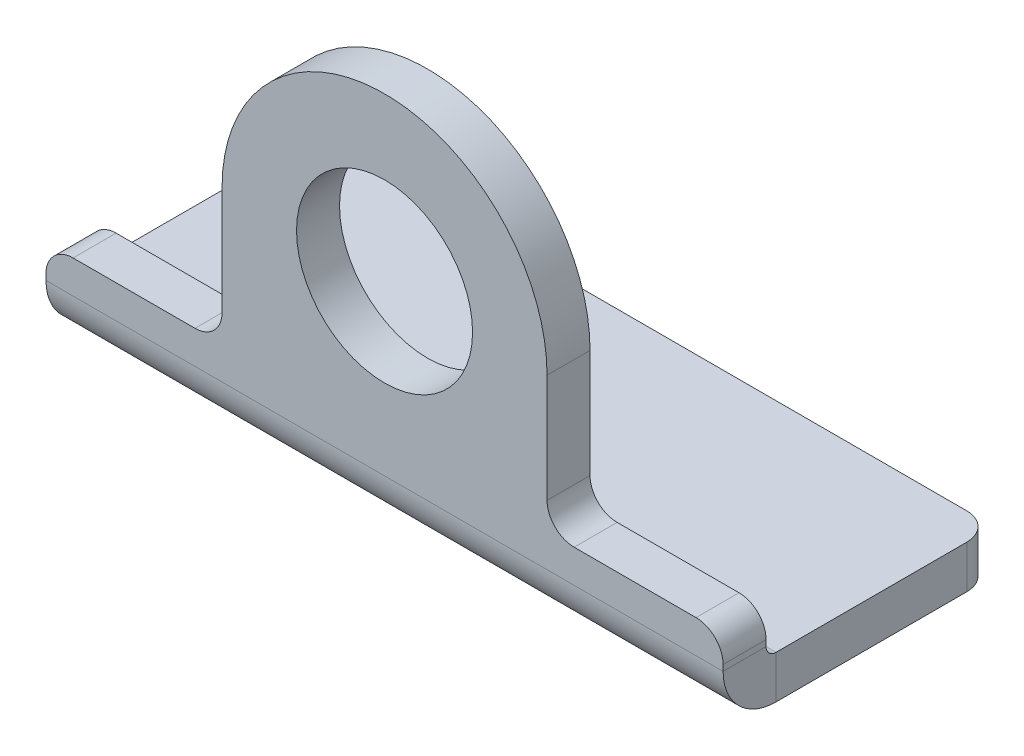
from build123d import *

# Parameters (mm, degrees)
SKETCH1_R                    = 6.5
BASE_FLANGE1_DEPTH           = 3.175
EDGE_FLANGE1_STRIP_W         = 14.1732
EDGE_FLANGE1_STRIP_H         = 3.175
EDGE_FLANGE1_STRIP_CUT_DEPTH = 50
EDGE_FLANGE1_DEPTH           = 50
FILLET2_R                    = 2


# Sheet-metal steps are written as plain solids
with BuildPart() as part:
    # Sketch1 → Base-Flange1 (new body)
    with BuildSketch(Plane.XY):
        with BuildLine():
            Line((-25, 0), (25, 0))
            Line((25, 0), (25, 1.175))
            ThreePointArc((25, 1.175), (24.414213562, 2.589213562), (23, 3.175))
            Line((23, 3.175), (14, 3.175))
            ThreePointArc((14, 3.175), (12.585786438, 3.760786438), (12, 5.175))
            Line((12, 5.175), (12, 13.175))
            ThreePointArc((12, 13.175), (0, 25.175), (-12, 13.175))
            Line((-12, 13.175), (-12, 5.175))
            ThreePointArc((-12, 5.175), (-12.585786438, 3.760786438), (-14, 3.175))
            Line((-14, 3.175), (-23, 3.175))
            ThreePointArc((-23, 3.175), (-24.414213562, 2.589213562), (-25, 1.175))
            Line((-25, 1.175), (-25, 0))
        make_face()
        with Locations((0, 13.175)):
            Circle(SKETCH1_R, mode=Mode.SUBTRACT)
    extrude(amount=-BASE_FLANGE1_DEPTH)

    # Edge-Flange1 strip (across the edge) → Edge-Flange1 strip cut (cut)
    with BuildSketch(Plane(origin=(25, 0, -3.175), x_dir=(0, 1, 0), z_dir=(-1, 0, 0))):
        with Locations((-6.35, -1.5875)):
            Rectangle(EDGE_FLANGE1_STRIP_W, EDGE_FLANGE1_STRIP_H)
    extrude(amount=EDGE_FLANGE1_STRIP_CUT_DEPTH, mode=Mode.SUBTRACT)

    # Edge-Flange1 section (across the edge) → Edge-Flange1 (add)
    with BuildSketch(Plane(origin=(25, 0, -3.175), x_dir=(0, 1, 0), z_dir=(-1, 0, 0))):
        with BuildLine():
            Line((-3.175, 0.7366), (-3.175, 16.825))
            Line((-3.175, 16.825), (0, 16.825))
            Line((0, 16.825), (0, 0.7366))
            ThreePointArc((0, 0.7366), (0.215745145, 0.215745145), (0.7366, 0))
            Line((0.7366, 0), (0.7366, -3.175))
            ThreePointArc((0.7366, -3.175), (-2.029318885, -2.029318885), (-3.175, 0.7366))
        make_face()
    extrude(amount=EDGE_FLANGE1_DEPTH)

    # Fillet2
    fillet2_edges = [part.edges().sort_by_distance(p)[0] for p in [
        (25, -1.5875, -20),
        (-25, -1.5875, -20),
    ]]
    fillet(fillet2_edges, radius=FILLET2_R)


solid = part.part
